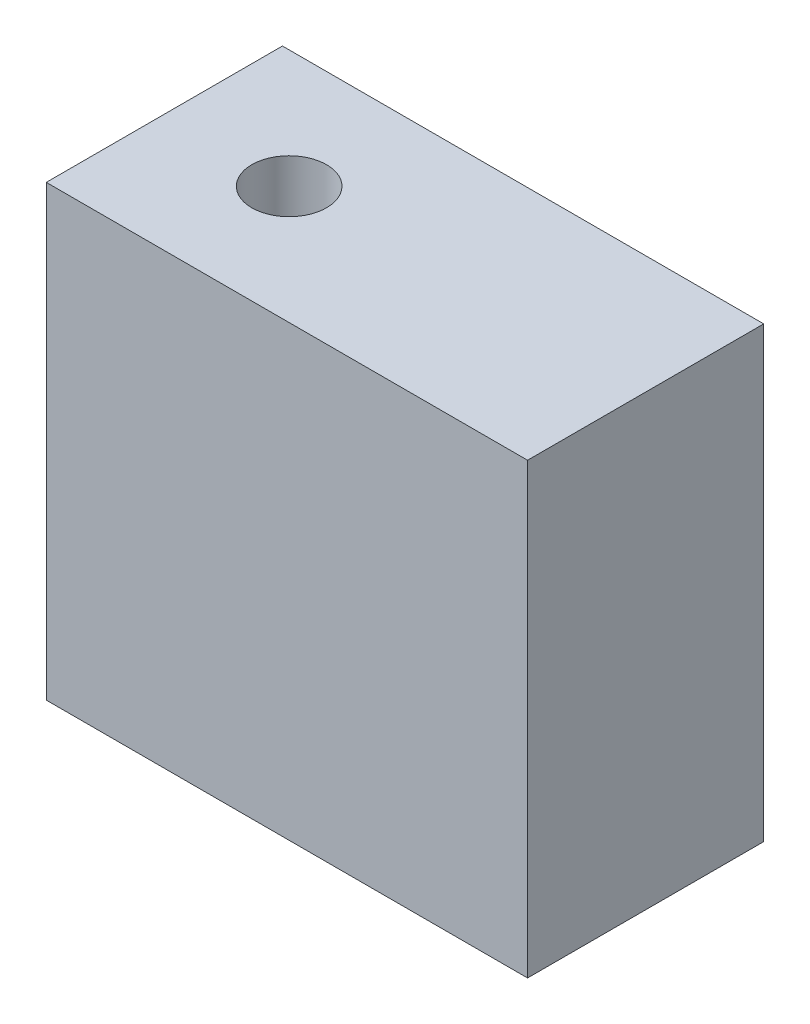
from build123d import *

# Parameters (mm, degrees)
SKETCH1_W           = 40.894
SKETCH1_H           = 20.066
BOSS_EXTRUDE1_DEPTH = 38.1
SKETCH2_R           = 3.175
CUT_EXTRUDE1_DEPTH  = 12.7


with BuildPart() as part:
    # Sketch1 → Boss-Extrude1 (new body)
    with BuildSketch(Plane(origin=(0, 0, 0), x_dir=(1, 0, 0), z_dir=(0, 1, 0))):
        with Locations((-20.447, -10.033)):
            Rectangle(SKETCH1_W, SKETCH1_H)
    extrude(amount=BOSS_EXTRUDE1_DEPTH)

    # Sketch2 → Cut-Extrude1 (cut)
    with BuildSketch(Plane(origin=(0, 38.1, 0), x_dir=(1, 0, 0), z_dir=(0, 1, 0))):
        with Locations((-30.2895, -10.033)):
            Circle(SKETCH2_R)
    extrude(amount=-CUT_EXTRUDE1_DEPTH, mode=Mode.SUBTRACT)


solid = part.part
